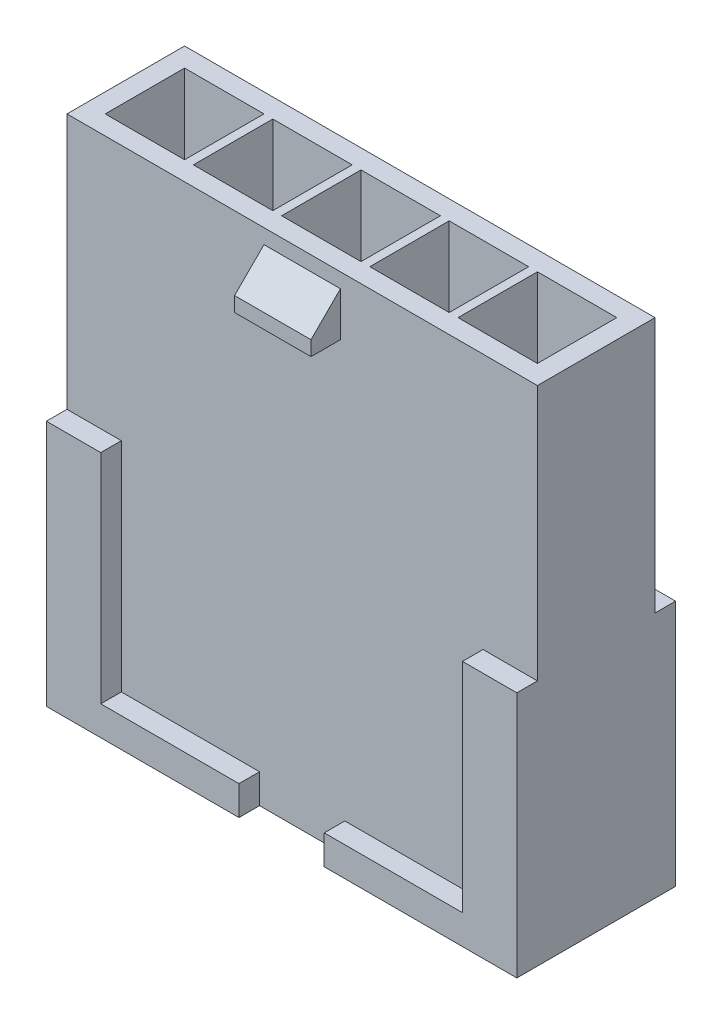
from build123d import *

# Parameters (mm, degrees)
SKETCH1_W           = 16
SKETCH1_H           = 4
SKETCH1_W_2         = 2.7
SKETCH1_H_2         = 2.7
BOSS_EXTRUDE1_DEPTH = 17.1
BOSS_EXTRUDE2_DEPTH = 0.7
BOSS_EXTRUDE3_DEPTH = 1.3
BOSS_EXTRUDE4_DEPTH = 0.7


with BuildPart() as part:
    # Sketch1 → Boss-Extrude1 (new body)
    with BuildSketch(Plane(origin=(0, 0, 0), x_dir=(1, 0, 0), z_dir=(0, 1, 0))):
        Rectangle(SKETCH1_W, SKETCH1_H)
        with Locations((3, 0)):
            Rectangle(SKETCH1_W_2, SKETCH1_H_2, mode=Mode.SUBTRACT)
        Rectangle(SKETCH1_W_2, SKETCH1_H_2, mode=Mode.SUBTRACT)
        with Locations((6, 0)):
            Rectangle(SKETCH1_W_2, SKETCH1_H_2, mode=Mode.SUBTRACT)
        with Locations((-6, 0)):
            Rectangle(SKETCH1_W_2, SKETCH1_H_2, mode=Mode.SUBTRACT)
        with Locations((-3, 0)):
            Rectangle(SKETCH1_W_2, SKETCH1_H_2, mode=Mode.SUBTRACT)
    extrude(amount=BOSS_EXTRUDE1_DEPTH)

    # Sketch2 → Boss-Extrude2 (add)
    with BuildSketch(Plane.XY.offset(2)):
        Polygon((1.45, 1), (1.45, 0), (8, 0), (8, 8.4), (6.15, 8.4), (6.15, 1), align=None)
        Polygon((-6.15, 8.4), (-8, 8.4), (-8, 0), (-1.45, 0), (-1.45, 1), (-6.15, 1), align=None)
    extrude(amount=BOSS_EXTRUDE2_DEPTH)

    # Sketch3 → Boss-Extrude3 (add, symmetric)
    with BuildSketch(Plane(origin=(0, 0, 0), x_dir=(0, 0, -1), z_dir=(1, 0, 0))):
        Polygon((-2, 16.6), (-3, 15.6), (-3, 15.1), (-2, 15.1), align=None)
    extrude(amount=BOSS_EXTRUDE3_DEPTH, both=True)

    # Sketch4 → Boss-Extrude4 (add)
    with BuildSketch(Plane(origin=(0, 0, -2), x_dir=(-1, 0, 0), z_dir=(0, 0, -1))):
        Polygon((6.15, 8.4), (6.15, 1), (-6.15, 1), (-6.15, 8.4), (-8, 8.4), (-8, 0), (8, 0), (8, 8.4), align=None)
    extrude(amount=BOSS_EXTRUDE4_DEPTH)


solid = part.part
